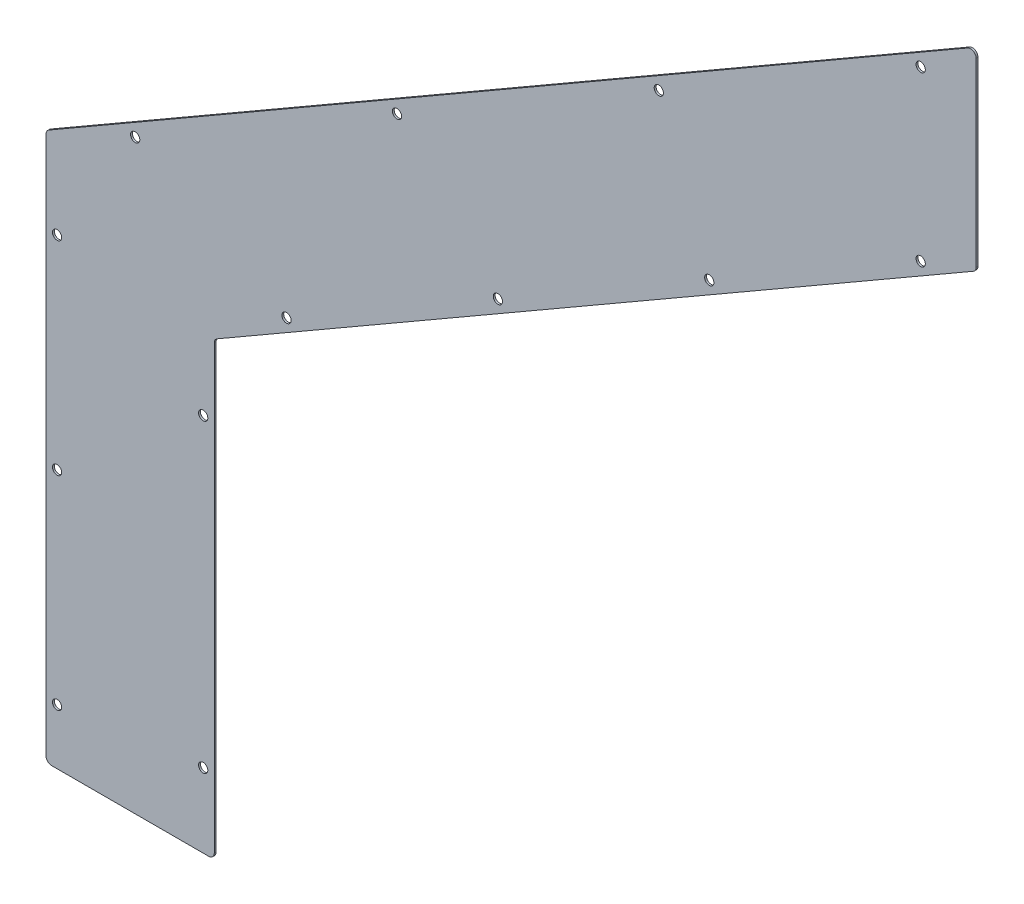
from build123d import *

# Parameters (mm, degrees)
BASE_FLANGE1_DEPTH = 1
FILLET1_R          = 3
SKETCH2_R          = 2.5
CUT_EXTRUDE1_DEPTH = 10


# Sheet-metal steps are written as plain solids
with BuildPart() as part:
    # Sketch1 → Base-Flange1 (new body)
    with BuildSketch(Plane.XY):
        Polygon((0, 0), (0, 243.736706628), (412, 481.605017534), (412, 586.417185402), (-91, 296.01), (-91, 0), align=None)
    extrude(amount=-BASE_FLANGE1_DEPTH)

    # Fillet1
    fillet1_edges = [part.edges().sort_by_distance(p)[0] for p in [
        (-91, 0, -0.5),
        (-91, 296.01, -0.5),
        (412, 586.417185402, -0.5),
        (412, 481.605017534, -0.5),
        (0, 243.736706628, -0.5),
        (0, 0, -0.5),
    ]]
    fillet(fillet1_edges, radius=FILLET1_R)

    # Sketch2 → Cut-Extrude1 (cut)
    with BuildSketch(Plane(origin=(0, 0, -1), x_dir=(-1, 0, 0), z_dir=(0, 0, -1))):
        with Locations((-382, 562.168474096)):
            Circle(SKETCH2_R)
        with Locations((-240.404846481, 480.418474096)):
            Circle(SKETCH2_R)
        with Locations((-98.809692962, 398.668474096)):
            Circle(SKETCH2_R)
        with Locations((42.785460556, 316.918474096)):
            Circle(SKETCH2_R)
        with Locations((-382, 471.212712688)):
            Circle(SKETCH2_R)
        with Locations((-267.6846467, 405.212712688)):
            Circle(SKETCH2_R)
        with Locations((-153.369293401, 339.212712688)):
            Circle(SKETCH2_R)
        with Locations((-39.053940101, 273.212712688)):
            Circle(SKETCH2_R)
        with Locations((85, 30)):
            Circle(SKETCH2_R)
        with Locations((6, 40)):
            Circle(SKETCH2_R)
        with Locations((85, 140)):
            Circle(SKETCH2_R)
        with Locations((85, 250)):
            Circle(SKETCH2_R)
        with Locations((6, 205)):
            Circle(SKETCH2_R)
    extrude(amount=-CUT_EXTRUDE1_DEPTH, mode=Mode.SUBTRACT)


solid = part.part
